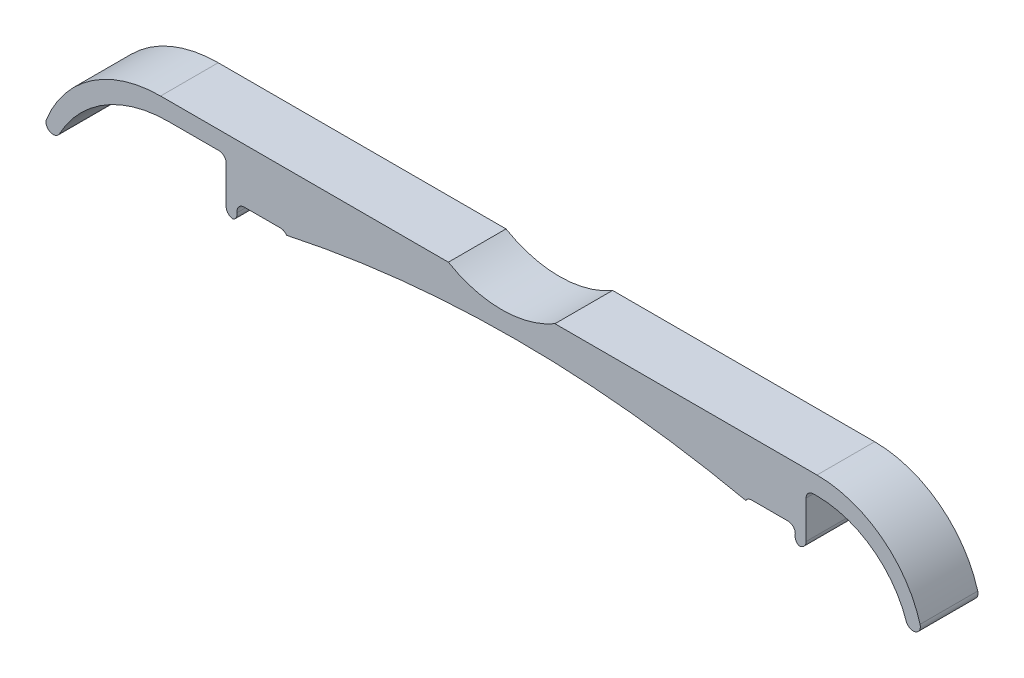
from build123d import *

# Parameters (mm, degrees)
EXTRUDE_1219_DEPTH     = 7.95
CUT_EXTRUDE_1748_DEPTH = 86.222223289
FILLET_1_R             = 1
CUT_EXTRUDE_3045_DEPTH = 86.222223289
FILLET_START           = -9
FILLET_2_DEPTH         = 10
FILLET_3_DEPTH         = 10


with BuildPart() as part:
    # Эскиз1 → Extrude 1219 (new body)
    with BuildSketch(Plane.XY):
        with BuildLine():
            Line((-59.003125249, 0), (-59.003125249, 7.5))
            Line((-59.003125249, 7.5), (-67.003125249, 7.5))
            ThreePointArc((-67.003125249, 7.5), (-75.989225627, 4.93086969), (-82.259271551, -2))
            Line((-82.259271551, -2), (-84.259271551, -2))
            ThreePointArc((-84.259271551, -2), (-78.132206164, 6.673633304), (-68.047161318, 10))
            Line((-68.047161318, 10), (0, 10))
            Line((0, 10), (22.496874751, 10))
            ThreePointArc((22.496874751, 10), (31.915339808, 6.61174951), (37.016858777, -2))
            Line((37.016858777, -2), (35.016858777, -2))
            ThreePointArc((35.016858777, -2), (30.354991574, 4.856157589), (22.496874751, 7.5))
            Line((22.496874751, 7.5), (20.996874751, 7.5))
            Line((20.996874751, 7.5), (20.996874751, 0))
            ThreePointArc((20.996874751, 0), (-19.003125249, 5.431677052), (-59.003125249, 0))
        make_face()
    extrude(amount=-EXTRUDE_1219_DEPTH)

    # Эскиз4 → Cut-Extrude 1748 (cut, through all)
    with BuildSketch(Plane.XY):
        with BuildLine():
            Line((-56.503125249, 2.5), (-51.503125249, 2.5))
            ThreePointArc((-51.503125249, 2.5), (-50.503125249, 1.5), (-51.503125249, 0.5))
            Line((-51.503125249, 0.5), (-56.503125249, 0.5))
            ThreePointArc((-56.503125249, 0.5), (-57.503125249, 1.5), (-56.503125249, 2.5))
        make_face()
        with BuildLine():
            Line((13.496874751, 2.5), (18.496874751, 2.5))
            ThreePointArc((18.496874751, 2.5), (19.496874751, 1.5), (18.496874751, 0.5))
            Line((18.496874751, 0.5), (13.496874751, 0.5))
            ThreePointArc((13.496874751, 0.5), (12.496874751, 1.5), (13.496874751, 2.5))
        make_face()
    extrude(amount=-CUT_EXTRUDE_1748_DEPTH, mode=Mode.SUBTRACT)

    # Скругление1
    # the kernel refuses this fillet: 1 mm, written as the material it adds along each edge
    with BuildSketch(Plane(origin=(20.996874751, 7.5, 0), x_dir=(0, -1, 0), z_dir=(0, 0, -1))) as fillet_1_piece_1:
        with BuildLine():
            CenterArc((FILLET_1_R, -FILLET_1_R), FILLET_1_R, 90, 90)
            Line((0, -FILLET_1_R), (0, 0))
            Line((0, 0), (FILLET_1_R, 0))
        make_face()
    extrude(amount=7.95)
    with BuildSketch(Plane(origin=(-59.003125249, 7.5, 0), x_dir=(0, -1, 0), z_dir=(0, 0, -1))) as fillet_1_piece_2:
        with BuildLine():
            CenterArc((FILLET_1_R, FILLET_1_R), FILLET_1_R, 180, 90)
            Line((0, FILLET_1_R), (0, 0))
            Line((0, 0), (FILLET_1_R, 0))
        make_face()
    extrude(amount=7.95)
    # the kernel refuses this fillet: 1 mm, written as the material it takes off along each edge
    with BuildSketch(Plane(origin=(20.996874751, 0, 3.270843206), x_dir=(-0.9649388241572373, 0.26247488572061173, 0), z_dir=(0, 0, -1))) as fillet_1_2_piece_1:
        with BuildLine():
            CenterArc((1.308344503, 0.999990553), FILLET_1_R, 164.783036074, 104.967917899)
            Line((0.343405679, 1.262465439), (0, 0))
            ThreePointArc((0, 0), (0.651998922, 0.001417015), (1.303997843, 0))
        make_face()
    extrude(amount=14.491686412, mode=Mode.SUBTRACT)
    with BuildSketch(Plane(origin=(-59.003125249, 0, 3.270843206), x_dir=(0, 1, 0), z_dir=(0, 0, -1))) as fillet_1_2_piece_2:
        with BuildLine():
            CenterArc((1.308337282, 1), FILLET_1_R, 165.032082101, 104.967917899)
            ThreePointArc((0.342266685, 1.258278146), (0.172500676, 0.628767142), (0, 0))
            Line((0, 0), (1.308337282, 0))
        make_face()
    extrude(amount=14.491686412, mode=Mode.SUBTRACT)
    with BuildSketch(Plane(origin=(18.869217353, 0.571904645, -11.41789989), x_dir=(0.6247425525309795, 0.7808308030918583, 0), z_dir=(0, 0, 1))) as fillet_1_2_piece_3:
        with BuildLine():
            CenterArc((1.476201521, -0.870557233), FILLET_1_R, 119.476541698, 84.032444608)
            ThreePointArc((0.559203998, -1.26945013), (0.281069449, -0.63407864), (0, 0))
            ThreePointArc((0, 0), (0.492067174, -0.129442767), (0.984134348, 0))
        make_face()
    extrude(amount=14.88579978, mode=Mode.SUBTRACT)
    with BuildSketch(Plane(origin=(-56.87546785, 0.571904645, -11.41789989), x_dir=(-0.9664237291257997, -0.2569536452019758, 0), z_dir=(0, 0, 1))) as fillet_1_2_piece_4:
        with BuildLine():
            CenterArc((1.391783822, -0.99998931), FILLET_1_R, 90.264928981, 84.032444608)
            ThreePointArc((0.396732806, -0.900623947), (0.316825083, -0.398129879), (0, 0))
            ThreePointArc((0, 0), (0.693579978, -0.001603519), (1.387159956, 0))
        make_face()
    extrude(amount=14.88579978, mode=Mode.SUBTRACT)

    # Эскиз3 → Cut-Extrude 3045 (cut, through all)
    with BuildSketch(Plane.XY):
        with BuildLine():
            Line((-28.348469228, 10), (-13.651530772, 10))
            ThreePointArc((-13.651530772, 10), (-21, 8), (-28.348469228, 10))
        make_face()
    extrude(amount=-CUT_EXTRUDE_3045_DEPTH, mode=Mode.SUBTRACT)

    # Скругление2: read off the stored shape, not the designer's step
    # Скругление2 outline → Скругление2 (cut)
    with BuildSketch(Plane.XY.offset(FILLET_START)):
        with BuildLine():
            add(Edge.make_bspline(
                [(-82.863119301, -2), (-82.449925955, -1.99999996), (-82.147973363, -1.770582651), (-81.991237502, -1.477750248)],
                knots=[0.617138018, 0.617138018, 0.617138018, 0.617138018, 1, 1, 1, 1], degree=3, weights=[0.553450152, 0.609956112, 0.758806062, 1]))
            Line((-82.863119301, -2), (-82.259271551, -2))
            ThreePointArc((-82.259271551, -2), (-82.127508876, -1.737718125), (-81.991237502, -1.477750248))
        make_face()
        with BuildLine():
            add(Edge.make_bspline(
                [(-83.781008367, -0.643067451), (-84.028353334, -1.25998415), (-83.741746006, -2.000000086), (-82.863119301, -2)],
                knots=[0, 0, 0, 0, 0.617138018, 0.617138018, 0.617138018, 0.617138018], degree=3, weights=[1, 0.611217733, 0.462367784, 0.553450152]))
            ThreePointArc((-83.781008367, -0.643067451), (-84.03454269, -1.316457352), (-84.259271551, -2))
            Line((-84.259271551, -2), (-82.863119301, -2))
        make_face()
    extrude(amount=FILLET_2_DEPTH, mode=Mode.SUBTRACT)

    # Скругление3: read off the stored shape, not the designer's step
    # Скругление3 outline → Скругление3 (cut)
    with BuildSketch(Plane.XY.offset(FILLET_START)):
        with BuildLine():
            add(Edge.make_bspline(
                [(35.753175475, -2), (36.580087454, -2.000000006), (36.88300902, -1.319995015), (36.713739215, -0.726922424)],
                knots=[0.42186979, 0.42186979, 0.42186979, 0.42186979, 1, 1, 1, 1], degree=3, weights=[0.524198025, 0.465452398, 0.624053056, 1]))
            Line((35.753175475, -2), (37.016858777, -2))
            ThreePointArc((37.016858777, -2), (36.879391808, -1.360105716), (36.713739215, -0.726922424))
        make_face()
        with BuildLine():
            add(Edge.make_bspline(
                [(34.80724517, -1.32210817), (34.931629097, -1.688611726), (35.257891746, -1.999999996), (35.753175475, -2)],
                knots=[0, 0, 0, 0, 0.42186979, 0.42186979, 0.42186979, 0.42186979], degree=3, weights=[1, 0.725666199, 0.567065541, 0.524198025]))
            ThreePointArc((34.80724517, -1.32210817), (34.916677882, -1.65962369), (35.016858777, -2))
            Line((35.016858777, -2), (35.753175475, -2))
        make_face()
    extrude(amount=FILLET_3_DEPTH, mode=Mode.SUBTRACT)


solid = part.part
